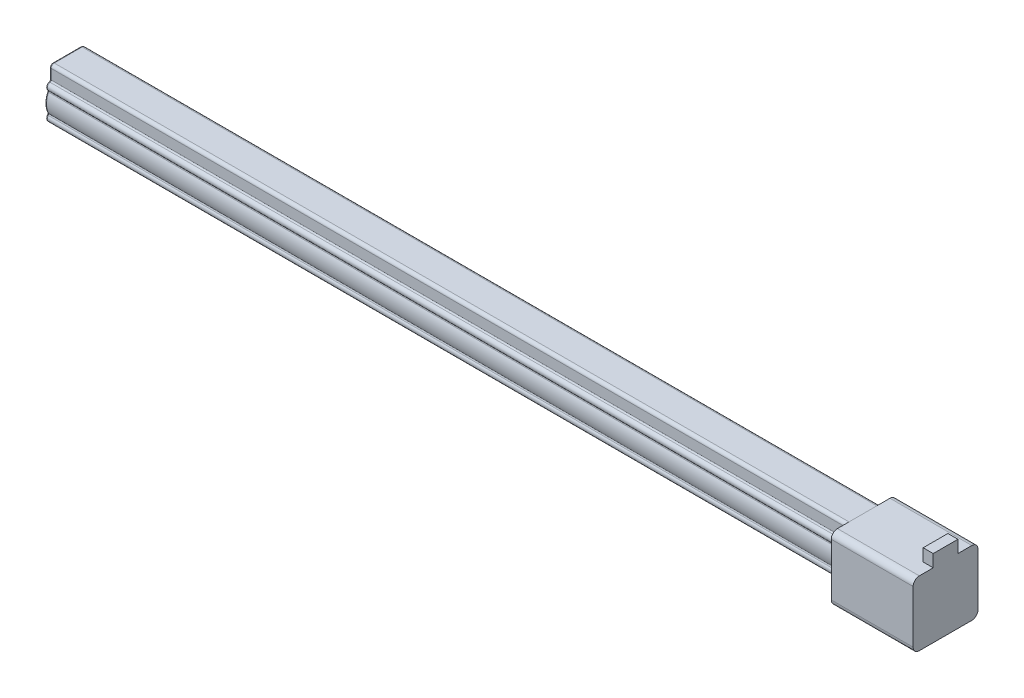
from build123d import *

# Parameters (mm, degrees)
SKETCH_1_W          = 516
SKETCH_1_H          = 35
SKETCH_1_W_2        = 5
SKETCH_1_H_2        = 42
SKETCH_1_W_3        = 48
EXTRUDE_1_DEPTH     = 42
SKETCH_3_W          = 516
SKETCH_3_H          = 42
CUT_EXTRUDE_1_DEPTH = 0.5
FILLET_1_R          = 7
SKETCH_4_R          = 10
CUT_EXTRUDE_2_DEPTH = 516
CUT_EXTRUDE_START   = -516
CUT_EXTRUDE_3_DEPTH = 516
FILLET_2_R          = 2
FILLET_3_R          = 4
FILLET_5_R          = 1
SKETCH_6_W          = 6.5
SKETCH_6_H          = 16
EXTRUDE_2_DEPTH     = 8


# Read off the part's stored shape, not the designer's step: Вырез-Вытянуть3
with BuildPart() as part:
    # Эскиз1 → Бобышка-Вытянуть1 (new body)
    with BuildSketch(Plane.XY):
        with Locations((-287, 3.5)):
            Rectangle(SKETCH_1_W, SKETCH_1_H)
        with Locations((-26.5, 0)):
            Rectangle(SKETCH_1_W_2, SKETCH_1_H_2)
        Rectangle(SKETCH_1_W_3, SKETCH_1_H_2)
    extrude(amount=EXTRUDE_1_DEPTH)

    # Эскиз3 → Вырез-Вытянуть1 (cut)
    with BuildSketch(Plane(origin=(0, 21, 0), x_dir=(1, 0, 0), z_dir=(0, 1, 0))):
        with Locations((-287, -21)):
            Rectangle(SKETCH_3_W, SKETCH_3_H)
    extrude(amount=-CUT_EXTRUDE_1_DEPTH, mode=Mode.SUBTRACT)

    # Скругление1
    fillet_1_edges = [part.edges().sort_by_distance(p)[0] for p in [
        (-287, -14, 42),
        (-287, -14, 0),
        (-287, 20.5, 0),
        (-287, 20.5, 42),
    ]]
    fillet(fillet_1_edges, radius=FILLET_1_R)

    # Эскиз4 → Вырез-Вытянуть2 (cut)
    with BuildSketch(Plane.ZY.offset(545)):
        with Locations((21, 0)):
            Circle(SKETCH_4_R)
    extrude(amount=-CUT_EXTRUDE_2_DEPTH, mode=Mode.SUBTRACT)

    # Вырез-Вытянуть3 outline → Вырез-Вытянуть3 (cut)
    with BuildSketch(Plane.ZY.offset(545).offset(CUT_EXTRUDE_START)):
        with BuildLine():
            ThreePointArc((11.715680056, -10.478616473), (8.035714286, -10.206727973), (8.63508525, -6.565735543))
            ThreePointArc((8.63508525, -6.565735543), (7, 0), (8.63508525, 6.565735543))
            ThreePointArc((8.63508525, 6.565735543), (7.60351338, 9.372189345), (10, 11.160254038))
            Line((10, 11.160254038), (10, 20.5))
            Line((10, 20.5), (7, 20.5))
            ThreePointArc((7, 20.5), (2.050252532, 18.449747468), (0, 13.5))
            Line((0, 13.5), (0, -7))
            ThreePointArc((0, -7), (2.050252532, -11.949747468), (7, -14))
            Line((7, -14), (21.000000051, -14))
            ThreePointArc((21.000000051, -14), (16.035155143, -13.090084627), (11.715680056, -10.478616473))
        make_face()
        with BuildLine():
            ThreePointArc((30.284319944, -10.478616473), (25.964844905, -13.090084609), (21.000000051, -14))
            Line((21.000000051, -14), (35, -14))
            ThreePointArc((35, -14), (39.949747468, -11.949747468), (42, -7))
            Line((42, -7), (42, 13.5))
            ThreePointArc((42, 13.5), (39.949747468, 18.449747468), (35, 20.5))
            Line((35, 20.5), (32, 20.5))
            Line((32, 20.5), (32, 11.160254038))
            ThreePointArc((32, 11.160254038), (34.39648662, 9.372189345), (33.36491475, 6.565735543))
            ThreePointArc((33.36491475, 6.565735543), (35, 0), (33.36491475, -6.565735543))
            ThreePointArc((33.36491475, -6.565735543), (33.964285714, -10.206727973), (30.284319944, -10.478616473))
        make_face()
    extrude(amount=CUT_EXTRUDE_3_DEPTH, mode=Mode.SUBTRACT)

    # Скругление2
    fillet_2_edges = [part.edges().sort_by_distance(p)[0] for p in [
        (-287, 20.5, 10),
        (-287, 20.5, 32),
    ]]
    fillet(fillet_2_edges, radius=FILLET_2_R)

    # Скругление3
    fillet_3_edges = [part.edges().sort_by_distance(p)[0] for p in [
        (-2.5, -21, 42),
        (-2.5, 21, 42),
        (-2.5, 21, 0),
        (-2.5, -21, 0),
    ]]
    fillet(fillet_3_edges, radius=FILLET_3_R)

    # Скругление5
    fillet_5_edges = [part.edges().sort_by_distance(p)[0] for p in [
        (-287, 11.160254038, 10),
        (-545, 9.372189345, 7.60351338),
        (-287, 6.565735543, 8.63508525),
        (-545, 0, 7),
        (-545, 14.830127019, 10),
        (-287, 6.565735543, 33.36491475),
        (-545, 9.372189345, 34.39648662),
        (-287, 11.160254038, 32),
        (-545, 14.830127019, 32),
        (-287, -10.478616473, 30.284319944),
        (-545, -10.206727973, 33.964285714),
        (-287, -6.565735543, 33.36491475),
        (-545, 0, 35),
        (-545, 20.5, 21),
        (-545, 19.914213562, 31.414213562),
        (-545, 19.914213562, 10.585786438),
        (-287, -6.565735543, 8.63508525),
        (-545, -10.206727973, 8.035714286),
        (-287, -10.478616473, 11.715680056),
        (-545, -13.090084627, 16.035155143),
    ]]
    fillet(fillet_5_edges, radius=FILLET_5_R)

    # Эскиз6 → Бобышка-Вытянуть2 (add)
    with BuildSketch(Plane(origin=(0, 21, 0), x_dir=(1, 0, 0), z_dir=(0, 1, 0))):
        with Locations((20.75, -21)):
            Rectangle(SKETCH_6_W, SKETCH_6_H)
    extrude(amount=EXTRUDE_2_DEPTH)


solid = part.part
